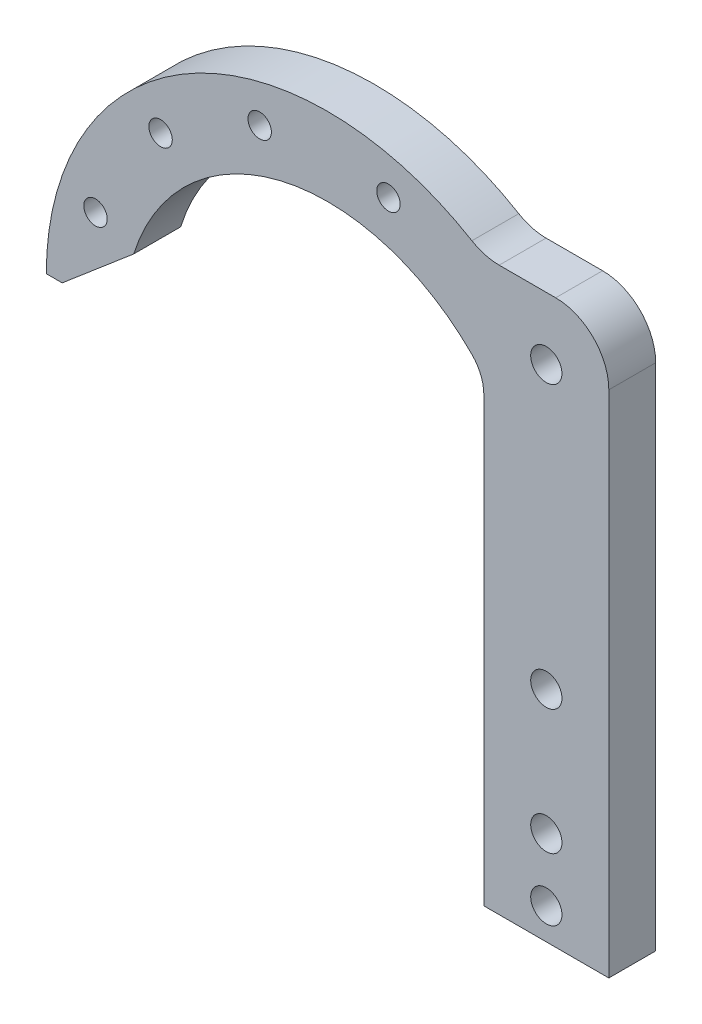
from build123d import *

# Parameters (mm, degrees)
BOSS_EXTRUDE1_DEPTH = 9.525
FILLET1_R           = 8.255
FILLET3_R           = 10.795
SKETCH2_R           = 3.175
CUT_EXTRUDE1_DEPTH  = 122.954832076
SKETCH3_R           = 3.175
SKETCH3_R_2         = 2.38125
CUT_EXTRUDE2_DEPTH  = 122.954832076


with BuildPart() as part:
    # Sketch1 → Boss-Extrude1 (new body)
    with BuildSketch(Plane.XY):
        with BuildLine():
            Line((12.7, 57.15), (-12.7, 57.15))
            ThreePointArc((-12.7, 57.15), (-71.390768363, 60.032513664), (-101.6, 9.630951188))
            Line((-101.6, 9.630951188), (-85.725, 9.630951188))
            ThreePointArc((-85.725, 9.630951188), (-58.470420375, 48.45173734), (-12.7, 36.004481953))
            Line((-12.7, 36.004481953), (-12.7, -57.15))
            Line((-12.7, -57.15), (12.7, -57.15))
            Line((12.7, -57.15), (12.7, 57.15))
        make_face()
    extrude(amount=BOSS_EXTRUDE1_DEPTH)

    # Fillet1
    fillet1_edges = [part.edges().sort_by_distance(p)[0] for p in [
        (-12.7, 36.004481953, 4.7625),
    ]]
    fillet(fillet1_edges, radius=FILLET1_R)

    # Chamfer1
    # the kernel refuses this chamfer: 16.925734726, 15.24 mm, written as the material it takes off along each edge
    with BuildSketch(Plane(origin=(-85.725, 9.630951188, -32.922584323), x_dir=(0.18505799374320953, 0.982727601602671, 0), z_dir=(0, 0, 1))) as chamfer1_piece_1:
        with BuildLine():
            Line((13.024984464, 0), (-2.866629235, 12.853244189))
            Line((-2.866629235, 12.853244189), (-3.199296969, 12.790599339))
            ThreePointArc((-3.199296969, 12.790599339), (-1.550509453, 6.404553068), (-0.332667734, -0.06264485))
            Line((-0.332667734, -0.06264485), (0.06264485, -0.332667734))
            ThreePointArc((0.06264485, -0.332667734), (6.502538231, 0.358645822), (12.985122864, -0.336159562))
            Line((12.985122864, -0.336159562), (13.024984464, 0))
        make_face()
    extrude(amount=75.370168646, mode=Mode.SUBTRACT)

    # Fillet3
    fillet3_edges = [part.edges().sort_by_distance(p)[0] for p in [
        (-12.7, 57.15, 4.7625),
        (12.7, 57.15, 4.7625),
    ]]
    fillet(fillet3_edges, radius=FILLET3_R)

    # Sketch2 → Cut-Extrude1 (cut, through all)
    with BuildSketch(Plane.XY.offset(9.525)):
        with Locations((0, -50.8)):
            Circle(SKETCH2_R)
        with Locations((0, -38.1)):
            Circle(SKETCH2_R)
    extrude(amount=-CUT_EXTRUDE1_DEPTH, mode=Mode.SUBTRACT)

    # Sketch3 → Cut-Extrude2 (cut, through all)
    with BuildSketch(Plane.XY.offset(9.525)):
        with Locations((0, -12.7)):
            Circle(SKETCH3_R)
        with Locations((0, 44.45)):
            Circle(SKETCH3_R)
        with Locations((-91.600885684, 25.42155909)):
            Circle(SKETCH3_R_2)
        with Locations((-78.380902496, 45.979860037)):
            Circle(SKETCH3_R_2)
        with Locations((-58.239749026, 57.405339102)):
            Circle(SKETCH3_R_2)
        with Locations((-32.074025979, 57.790940658)):
            Circle(SKETCH3_R_2)
    extrude(amount=-CUT_EXTRUDE2_DEPTH, mode=Mode.SUBTRACT)


solid = part.part
